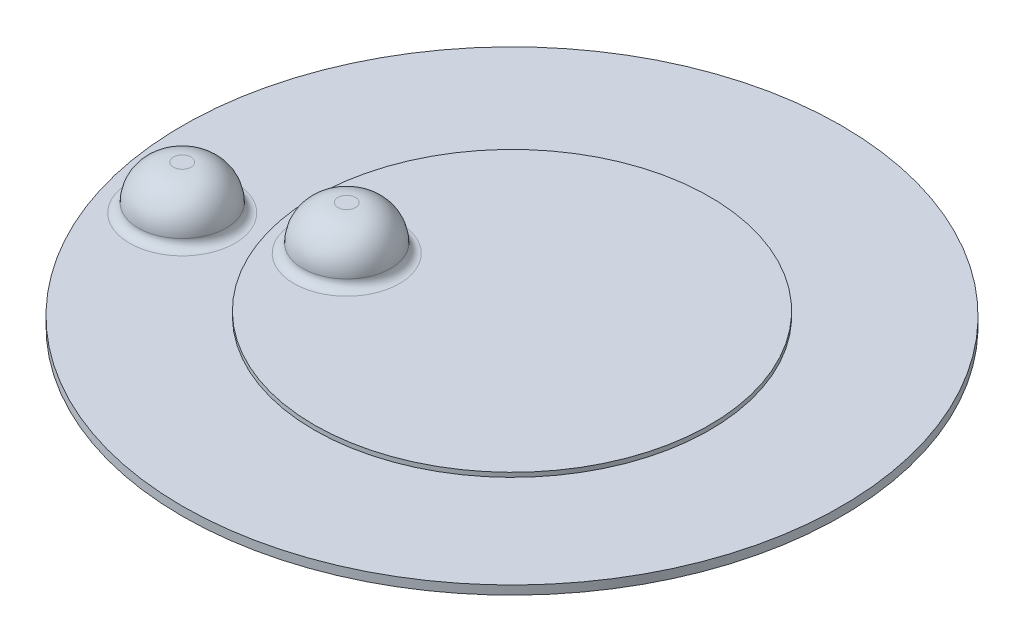
from build123d import *

# Parameters (mm, degrees)
SKETCH_1_R      = 7.5
EXTRUDE_1_DEPTH = 0.2
SKETCH_2_R      = 4.5
EXTRUDE_2_DEPTH = 0.1
SKETCH_3_R      = 1
EXTRUDE_3_DEPTH = 1
FILLET_1_R      = 0.8
SKETCH_4_R      = 1
EXTRUDE_4_DEPTH = 1
FILLET_2_R      = 0.8
FILLET_3_R      = 0.2


with BuildPart() as part:
    # 草图1 → 凸台-拉伸1 (new body)
    with BuildSketch(Plane(origin=(0, 0, 0), x_dir=(1, 0, 0), z_dir=(0, 1, 0))):
        with Locations(Location((0, 0, 0), (0, 0, 270))):
            Circle(SKETCH_1_R)
    extrude(amount=EXTRUDE_1_DEPTH)

    # 草图2 → 凸台-拉伸2 (add)
    with BuildSketch(Plane(origin=(0, 0.2, 0), x_dir=(1, 0, 0), z_dir=(0, 1, 0))):
        with Locations(Location((0, 0, 0), (0, 0, 270))):
            Circle(SKETCH_2_R)
    extrude(amount=EXTRUDE_2_DEPTH)

    # 草图3 → 凸台-拉伸3 (add)
    with BuildSketch(Plane(origin=(0, 0.2, 0), x_dir=(1, 0, 0), z_dir=(0, 1, 0))):
        with Locations(Location((-5.78398758, -1.72100244, 0), (0, 0, 270))):
            Circle(SKETCH_3_R)
    extrude(amount=EXTRUDE_3_DEPTH)

    # 圆角1
    fillet_1_edges = [part.edges().sort_by_distance(p)[0] for p in [
        (-5.78398758, 1.2, 0.72100244),
    ]]
    fillet(fillet_1_edges, radius=FILLET_1_R)

    # 草图4 → 凸台-拉伸4 (add)
    with BuildSketch(Plane(origin=(0, 0.3, 0), x_dir=(1, 0, 0), z_dir=(0, 1, 0))):
        with Locations(Location((-3.016189843, -0.745176314, 0), (0, 0, 270))):
            Circle(SKETCH_4_R)
    extrude(amount=EXTRUDE_4_DEPTH)

    # 圆角2
    fillet_2_edges = [part.edges().sort_by_distance(p)[0] for p in [
        (-3.016189843, 1.3, -0.254823686),
    ]]
    fillet(fillet_2_edges, radius=FILLET_2_R)

    # 圆角3
    fillet_3_edges = [part.edges().sort_by_distance(p)[0] for p in [
        (-5.78398758, 0.2, 0.72100244),
        (-3.016189843, 0.3, -0.254823686),
    ]]
    fillet(fillet_3_edges, radius=FILLET_3_R - 0.0001)  # a hair under: the kernel refuses the full size


solid = part.part
